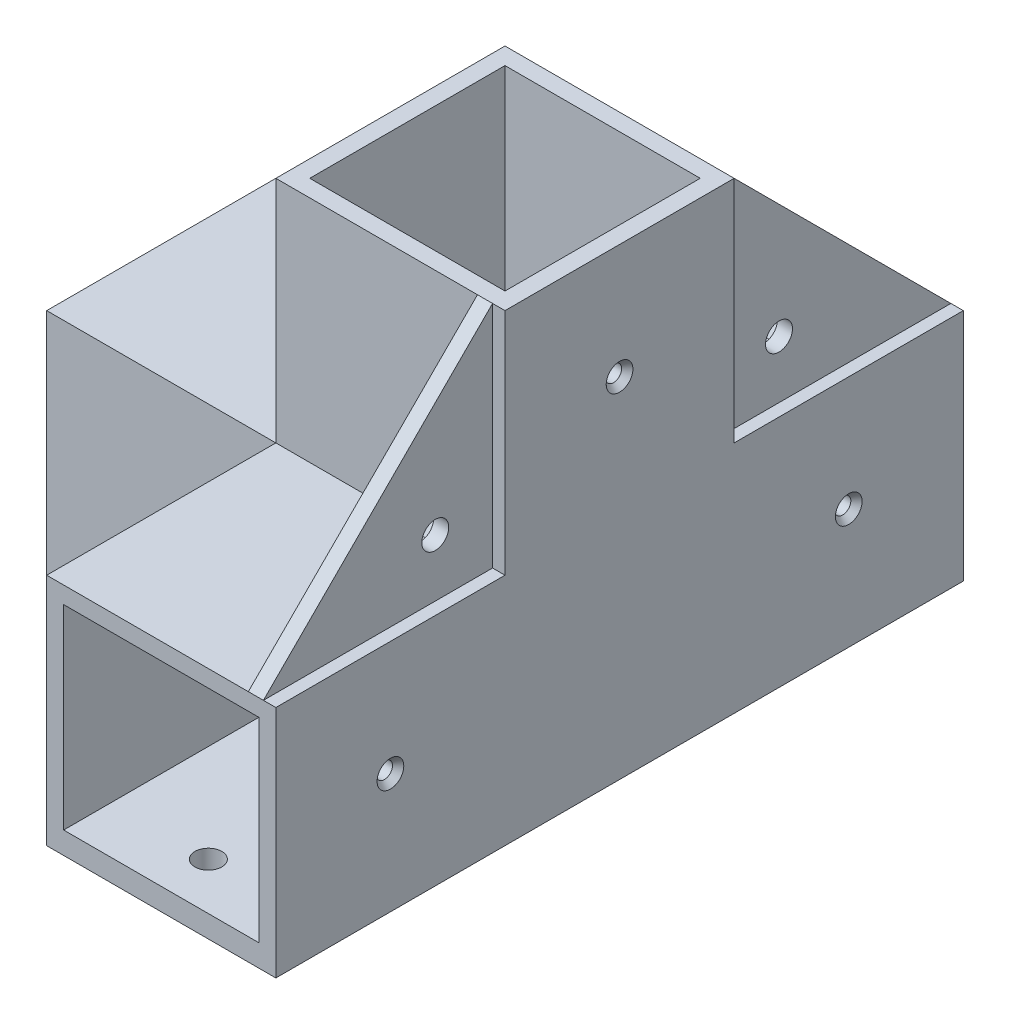
from build123d import *
from build123d.topology import SkipClean

# Parameters (mm, degrees)
ESQUISSE1_W                                       = 60.8
ESQUISSE1_H                                       = 121.6
BOSS_EXTRU_1_DEPTH                                = 91.2
ESQUISSE2_W                                       = 60.8
ESQUISSE2_H                                       = 60.8
ENL_V_MAT_EXTRU_1_DEPTH                           = 126.342411019
ESQUISSE3_W                                       = 51.8
ESQUISSE3_H                                       = 51.8
ENL_V_MAT_EXTRU_2_DEPTH                           = 60.8
BOSS_EXTRU_3_DEPTH                                = 4
ESQUISSE6_W                                       = 51.8
ESQUISSE6_H                                       = 51.8
ENL_V_MAT_EXTRU_3_DEPTH                           = 60.8
D_GAGEMENT_1_43_D                                 = 7.14248
FRAISAGE_POUR_VIS_T_TE_FRAIS_E_BOMB_E_D           = 4.3053
FRAISAGE_POUR_VIS_T_TE_FRAIS_E_BOMB_E_DEPTH       = 4.5
FRAISAGE_POUR_VIS_T_TE_FRAIS_E_BOMB_E_CSINK_D     = 7.0866
FRAISAGE_POUR_VIS_T_TE_FRAIS_E_BOMB_E_CSINK_ANGLE = 82
D_GAGEMENT_1_42_D                                 = 7.14248
D_GAGEMENT_1_42_DEPTH                             = 20
BOSS_EXTRU_5_DEPTH                                = 4
CHANFREIN1_SIZE                                   = 4
ESQUISSE26_W                                      = 60.8
ESQUISSE26_H                                      = 60.8
ESQUISSE26_W_2                                    = 51.800000032
ESQUISSE26_H_2                                    = 51.800000032
BOSS_EXTRU_8_DEPTH                                = 60.800000066
ESQUISSE27_R                                      = 3.57124
BOSS_EXTRU_9_DEPTH                                = 1.35


with BuildPart() as part:
    # Esquisse1 → Boss.-Extru.1 (new, symmetric)
    with BuildSketch(Plane.XY):
        Rectangle(ESQUISSE1_W, ESQUISSE1_H)
    extrude(amount=BOSS_EXTRU_1_DEPTH, both=True)

    # Esquisse2 → Enlèv. mat.-Extru.1 (cut, through all)
    with BuildSketch(Plane.ZY.offset(30.4)):
        with Locations((-60.8, 30.4)):
            Rectangle(ESQUISSE2_W, ESQUISSE2_H)
    enl_v_mat_extru_1 = extrude(amount=-ENL_V_MAT_EXTRU_1_DEPTH, mode=Mode.SUBTRACT)

    # Esquisse3 → Enlèv. mat.-Extru.2 (cut)
    with BuildSketch(Plane(origin=(0, 0, -91.2), x_dir=(-1, 0, 0), z_dir=(0, 0, -1))):
        with Locations((0, -30.4)):
            Rectangle(ESQUISSE3_W, ESQUISSE3_H)
    enl_v_mat_extru_2 = extrude(amount=-ENL_V_MAT_EXTRU_2_DEPTH, mode=Mode.SUBTRACT)

    # Symétrie2: Enlèv. mat.-Extru.1, Enlèv. mat.-Extru.2 across plane
    add(enl_v_mat_extru_1.mirror(Plane.XY), mode=Mode.SUBTRACT)
    add(enl_v_mat_extru_2.mirror(Plane.XY), mode=Mode.SUBTRACT)

    # Esquisse10 → Boss.-Extru.3 (add)
    with BuildSketch(Plane(origin=(27.1, 0, 0), x_dir=(0, 0, -1), z_dir=(1, 0, 0))):
        Polygon((30.4, 60.8), (30.4, 0), (91.2, 0), align=None)
        Polygon((-30.4, 60.8), (-91.2, 0), (-30.4, 0), align=None)
    extrude(amount=-BOSS_EXTRU_3_DEPTH)

    # Esquisse6 → Enlèv. mat.-Extru.3 (cut)
    with BuildSketch(Plane(origin=(0, 60.8, 0), x_dir=(1, 0, 0), z_dir=(0, 1, 0))):
        Rectangle(ESQUISSE6_W, ESQUISSE6_H)
    extrude(amount=-ENL_V_MAT_EXTRU_3_DEPTH, mode=Mode.SUBTRACT)

    # Dégagement 1/43 (through all)
    with Locations(Plane(origin=(27.1, 0, 0), x_dir=(0, 0, -1), z_dir=(1, 0, 0))):
        with Locations((45.6, 15.2), (-45.6, 15.2)):
            Hole(D_GAGEMENT_1_43_D / 2)

    # Fraisage pour vis _ t_te frais_e bomb_e
    with Locations(Plane(origin=(30.4, 0, 0), x_dir=(0, 0, -1), z_dir=(1, 0, 0))):
        with Locations((-60.8, -30.4), (0, 30.4), (60.8, -30.4)):
            CounterSinkHole(FRAISAGE_POUR_VIS_T_TE_FRAIS_E_BOMB_E_D / 2, FRAISAGE_POUR_VIS_T_TE_FRAIS_E_BOMB_E_CSINK_D / 2, depth=FRAISAGE_POUR_VIS_T_TE_FRAIS_E_BOMB_E_DEPTH, counter_sink_angle=FRAISAGE_POUR_VIS_T_TE_FRAIS_E_BOMB_E_CSINK_ANGLE)

    # Dégagement 1/42
    with Locations(Plane(origin=(0, -60.8, 0), x_dir=(-1, 0, 0), z_dir=(0, -1, 0))):
        with Locations((0, 78.7), (0, -78.7)):
            Hole(D_GAGEMENT_1_42_D / 2, depth=D_GAGEMENT_1_42_DEPTH)

    # Esquisse23 → Boss.-Extru.5 (add)
    # profile 1 of 2: a face of its own
    with BuildSketch(Plane.ZY.offset(-23.1)):
        Polygon((-41.197704197, 22.825), (-50.002295803, 22.825), (-54.404591605, 15.2), (-50.002295803, 7.575), (-41.197704197, 7.575), (-36.795408395, 15.2), align=None)
        Polygon((-40.25951001, 15.2), (-42.929755005, 19.825), (-48.270244995, 19.825), (-50.94048999, 15.2), (-48.270244995, 10.575), (-42.929755005, 10.575), align=None, mode=Mode.SUBTRACT)
    # profile 2 of 2: a face of its own
    with BuildSketch(Plane.ZY.offset(-23.1)):
        Polygon((54.404591605, 15.2), (50.002295803, 22.825), (41.197704197, 22.825), (36.795408395, 15.2), (41.197704197, 7.575), (50.002295803, 7.575), align=None)
        Polygon((50.94048999, 15.2), (48.270244995, 19.825), (42.929755005, 19.825), (40.25951001, 15.2), (42.929755005, 10.575), (48.270244995, 10.575), align=None, mode=Mode.SUBTRACT)
    extrude(amount=BOSS_EXTRU_5_DEPTH)

    # Chanfrein1
    chanfrein1_edges = [part.edges().sort_by_distance(p)[0] for p in [
        (23.1, 19.0125, 38.996556296),
        (23.1, 11.3875, 38.996556296),
        (23.1, 7.575, 45.6),
        (23.1, 11.3875, 52.203443704),
        (23.1, 19.0125, 52.203443704),
        (23.1, 22.825, 45.6),
        (23.1, 11.3875, -38.996556296),
        (23.1, 19.0125, -38.996556296),
        (23.1, 7.575, -45.6),
        (23.1, 11.3875, -52.203443704),
        (23.1, 22.825, -45.6),
        (23.1, 19.0125, -52.203443704),
    ]]
    chamfer(chanfrein1_edges, length=CHANFREIN1_SIZE - 0.0001)  # a hair under: the kernel refuses the full size

    # Esquisse26 → Boss.-Extru.8 (add)
    with BuildSketch(Plane.ZY.offset(30.4)):
        with Locations((0, -30.4)):
            Rectangle(ESQUISSE26_W, ESQUISSE26_H)
        with Locations((0, -30.4)):
            Rectangle(ESQUISSE26_W_2, ESQUISSE26_H_2, mode=Mode.SUBTRACT)
    extrude(amount=BOSS_EXTRU_8_DEPTH)

    # Esquisse27 → Boss.-Extru.9 (add)
    with SkipClean():  # the faces are left unmerged after this step: merging them gives an invalid solid
        with BuildSketch(Plane.XZ.offset(60.8)):
            Polygon((-30.4, -91.2), (30.4, -91.2), (30.4, 91.2), (-30.4, 91.2), (-30.4, 30.4), (-91.200000066, 30.4), (-91.200000066, -30.4), (-30.4, -30.4), align=None)
            with Locations(Location((0, 78.7, 0), (0, 0, 270))):
                Circle(ESQUISSE27_R, mode=Mode.SUBTRACT)
            with Locations(Location((0, -78.7, 0), (0, 0, 270))):
                Circle(ESQUISSE27_R, mode=Mode.SUBTRACT)
        extrude(amount=BOSS_EXTRU_9_DEPTH)
    add(part.part.scale(1), mode=Mode.REPLACE)  # the faces are merged on a copy


solid = part.part
